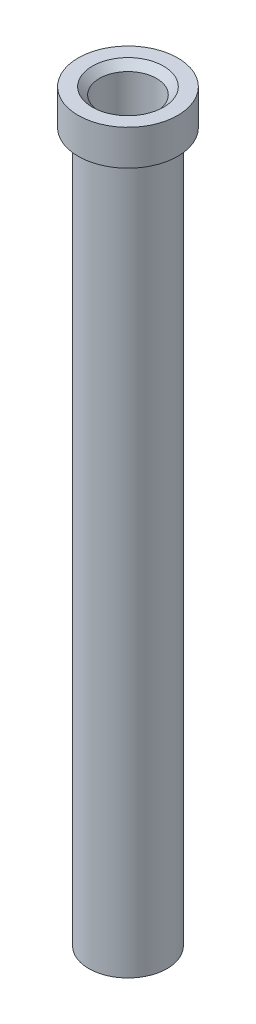
from build123d import *

# Parameters (mm, degrees)
SKETCH1_R                       = 2.8067
BOSS_EXTRUDE1_DEPTH             = 53.34
F_20_0_161_DIAMETER_HOLE1_D     = 4.0894
F_20_0_161_DIAMETER_HOLE1_DEPTH = 49.53
F_20_0_161_DIAMETER_HOLE1_TIP   = 1.228579708
BOSS_EXTRUDE2_START             = -2.54
SKETCH5_R                       = 3.5687
SKETCH5_R_2                     = 2.8067
BOSS_EXTRUDE2_DEPTH             = 2.54
CHAMFER1_SIZE                   = 0.508


with BuildPart() as part:
    # Sketch1 → Boss-Extrude1 (new body)
    with BuildSketch(Plane(origin=(0, 0, 0), x_dir=(1, 0, 0), z_dir=(0, 1, 0))):
        Circle(SKETCH1_R)
    extrude(amount=BOSS_EXTRUDE1_DEPTH)

    # #20 (0.161) Diameter Hole1
    with Locations(Plane.ZX.offset(53.34)):
        with Locations((0, 0)):
            Hole(F_20_0_161_DIAMETER_HOLE1_D / 2, depth=F_20_0_161_DIAMETER_HOLE1_DEPTH)
            with Locations((0, 0, -(F_20_0_161_DIAMETER_HOLE1_DEPTH + F_20_0_161_DIAMETER_HOLE1_TIP / 2))):  # 118° drill point
                Cone(0, F_20_0_161_DIAMETER_HOLE1_D / 2, F_20_0_161_DIAMETER_HOLE1_TIP, mode=Mode.SUBTRACT)

    # Sketch5 → Boss-Extrude2 (add)
    with BuildSketch(Plane(origin=(0, 53.34, 0), x_dir=(1, 0, 0), z_dir=(0, 1, 0)).offset(BOSS_EXTRUDE2_START)):
        Circle(SKETCH5_R)
        Circle(SKETCH5_R_2, mode=Mode.SUBTRACT)
    extrude(amount=BOSS_EXTRUDE2_DEPTH)

    # Chamfer1
    chamfer1_edges = [part.edges().sort_by_distance(p)[0] for p in [
        (0, 53.34, 2.0447),
    ]]
    chamfer(chamfer1_edges, length=CHAMFER1_SIZE)


solid = part.part
